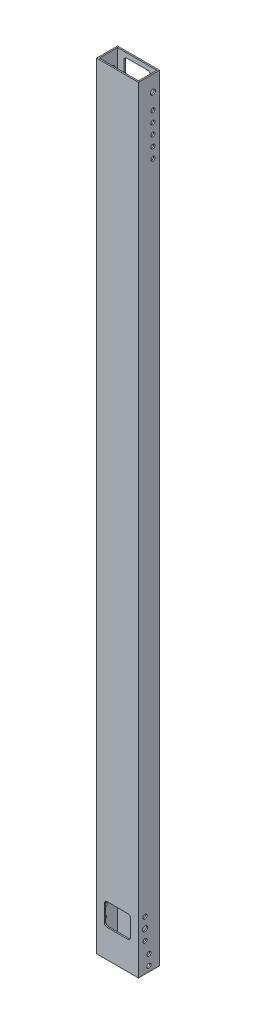
from build123d import *

# Parameters (mm, degrees)
SKETCH1_W               = 50.8
SKETCH1_H               = 939.8
BOSS_EXTRUDE1_DEPTH     = 12.7
SHELL1_T                = -1.5875
CUT_EXTRUDE1_DEPTH      = 471.757326018
CUT_EXTRUDE1_DEPTH_BACK = 471.757326018
SKETCH3_R               = 2.4892
CUT_EXTRUDE2_DEPTH      = 471.757326018
CUT_EXTRUDE2_DEPTH_BACK = 471.757326018
SKETCH4_R               = 3.175
SKETCH4_R_2             = 2.4892
SKETCH5_W               = 31.75
SKETCH5_H               = 26.9875
CUT_EXTRUDE3_DEPTH      = 471.757326018
FILLET1_R               = 3.175
CUT_EXTRUDE4_DEPTH      = 471.757326018
CUT_EXTRUDE4_DEPTH_BACK = 471.757326018
SKETCH6_R               = 3.175
SKETCH7_W               = 31.75
SKETCH7_H               = 26.9875
CUT_EXTRUDE5_DEPTH      = 471.757326018
FILLET2_R               = 3.175
CUT_EXTRUDE6_DEPTH      = 471.757326018
CUT_EXTRUDE6_DEPTH_BACK = 471.757326018
SKETCH8_R               = 2.4892


with BuildPart() as part:
    # Sketch1 → Boss-Extrude1 (new, symmetric)
    with BuildSketch(Plane.XY):
        Rectangle(SKETCH1_W, SKETCH1_H)
    extrude(amount=BOSS_EXTRUDE1_DEPTH, both=True)

    # Shell1
    shell1_openings = [part.faces().sort_by_distance(p)[0] for p in [
        (0, -469.9, 0),
        (0, 469.9, 0),
    ]]
    offset(amount=SHELL1_T, openings=shell1_openings, kind=Kind.INTERSECTION)

    # Sketch3 → Cut-Extrude1 (cut, two sides: drawn at the far end of the back side and taken through both)
    with BuildSketch(Plane(origin=(0, 0, 0), x_dir=(0, 0, -1), z_dir=(1, 0, 0)).offset(-CUT_EXTRUDE1_DEPTH_BACK)):
        with Locations((0, -463.55)):
            Circle(SKETCH3_R)
        with Locations((0, -450.85)):
            Circle(SKETCH3_R)
    extrude(amount=CUT_EXTRUDE1_DEPTH + CUT_EXTRUDE1_DEPTH_BACK, mode=Mode.SUBTRACT)

    # Sketch4 → Cut-Extrude2 (cut, two sides: drawn at the far end of the back side and taken through both)
    with BuildSketch(Plane(origin=(0, 0, 0), x_dir=(0, 0, -1), z_dir=(1, 0, 0)).offset(-CUT_EXTRUDE2_DEPTH_BACK)):
        with Locations((-4.7625, -422.275)):
            Circle(SKETCH4_R)
        with Locations((-4.7625, -409.575)):
            Circle(SKETCH4_R_2)
        with Locations((-4.7625, -434.975)):
            Circle(SKETCH4_R_2)
    extrude(amount=CUT_EXTRUDE2_DEPTH + CUT_EXTRUDE2_DEPTH_BACK, mode=Mode.SUBTRACT)

    # Sketch5 → Cut-Extrude3 (cut, through all)
    with BuildSketch(Plane.XY):
        with Locations((0, -422.275)):
            Rectangle(SKETCH5_W, SKETCH5_H)
    extrude(amount=CUT_EXTRUDE3_DEPTH, mode=Mode.SUBTRACT)

    # Fillet1
    fillet1_edges = [part.edges().sort_by_distance(p)[0] for p in [
        (-15.875, -435.76875, 11.90625),
        (15.875, -435.76875, 11.90625),
        (-15.875, -408.78125, 11.90625),
        (15.875, -408.78125, 11.90625),
    ]]
    fillet(fillet1_edges, radius=FILLET1_R)

    # Sketch6 → Cut-Extrude4 (cut, two sides: drawn at the far end of the back side and taken through both)
    with BuildSketch(Plane(origin=(0, 0, 0), x_dir=(0, 0, -1), z_dir=(1, 0, 0)).offset(-CUT_EXTRUDE4_DEPTH_BACK)):
        with Locations((4.7625, 450.85)):
            Circle(SKETCH6_R)
    extrude(amount=CUT_EXTRUDE4_DEPTH + CUT_EXTRUDE4_DEPTH_BACK, mode=Mode.SUBTRACT)

    # Sketch7 → Cut-Extrude5 (cut, through all)
    with BuildSketch(Plane.XY):
        with Locations((0, 450.85)):
            Rectangle(SKETCH7_W, SKETCH7_H)
    extrude(amount=-CUT_EXTRUDE5_DEPTH, mode=Mode.SUBTRACT)

    # Fillet2
    fillet2_edges = [part.edges().sort_by_distance(p)[0] for p in [
        (15.875, 437.35625, -11.90625),
        (-15.875, 437.35625, -11.90625),
        (-15.875, 464.34375, -11.90625),
        (15.875, 464.34375, -11.90625),
    ]]
    fillet(fillet2_edges, radius=FILLET2_R)

    # Sketch8 → Cut-Extrude6 (cut, two sides: drawn at the far end of the back side and taken through both)
    with BuildSketch(Plane(origin=(0, 0, 0), x_dir=(0, 0, -1), z_dir=(1, 0, 0)).offset(-CUT_EXTRUDE6_DEPTH_BACK)):
        with Locations((4.7625, 431.8)):
            Circle(SKETCH8_R)
        with Locations((4.7625, 419.1)):
            Circle(SKETCH8_R)
        with Locations((4.7625, 406.4)):
            Circle(SKETCH8_R)
        with Locations((4.7625, 393.7)):
            Circle(SKETCH8_R)
        with Locations((4.7625, 381)):
            Circle(SKETCH8_R)
    extrude(amount=CUT_EXTRUDE6_DEPTH + CUT_EXTRUDE6_DEPTH_BACK, mode=Mode.SUBTRACT)


solid = part.part
